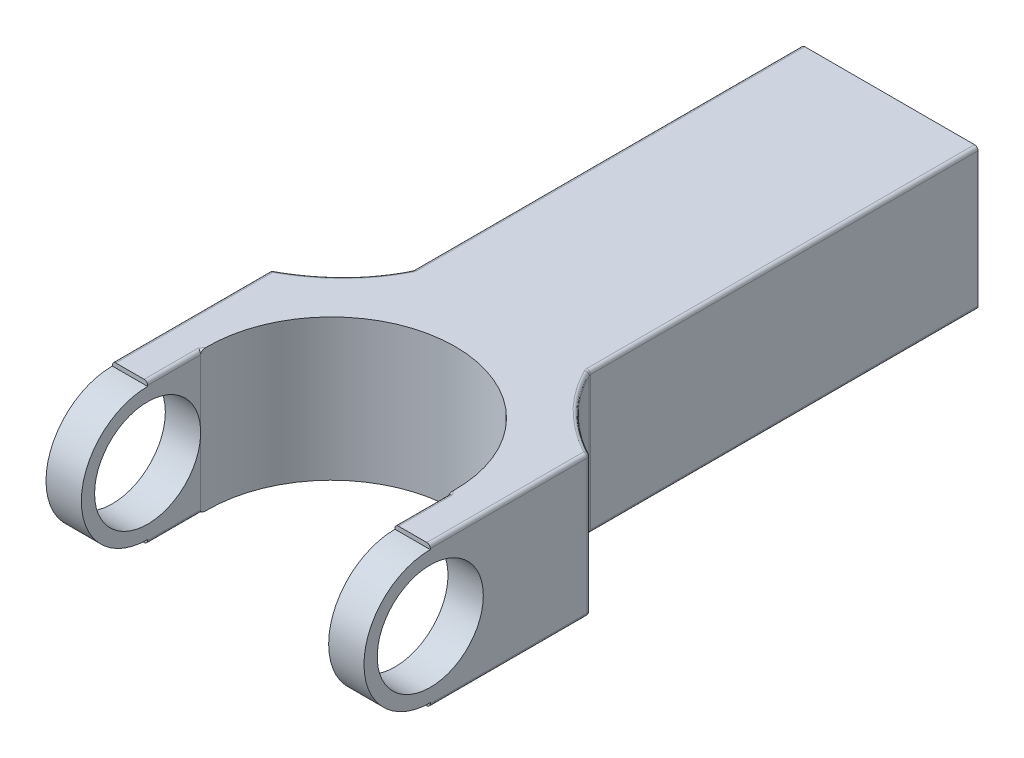
from build123d import *

# Parameters (mm, degrees)
BOSS_EXTRUDE4_DEPTH = 80
SKETCH7_R           = 30
CUT_EXTRUDE5_DEPTH  = 40
FILLET2_R           = 2
CUT_EXTRUDE6_DEPTH  = 305.00000000000017
CUT_EXTRUDE7_DEPTH  = 305.00000000000017
CUT_EXTRUDE8_DEPTH  = 305.00000000000017


with BuildPart() as part:
    # Sketch1 → Boss-Extrude4 (new body)
    with BuildSketch(Plane(origin=(0, 0, 0), x_dir=(1, 0, 0), z_dir=(0, 1, 0))):
        with BuildLine():
            Line((0, 199.83872485399064), (0, 59.951617456197184))
            add(Edge.make_bspline(
                [(69.94355369889674, 0), (40.61007984038975, 38.24826155662546), (4.77e-15, 59.951617456197184)],
                knots=[0, 0, 0, 0.9866116392258861, 0.9866116392258861, 0.9866116392258861], degree=2))
            Line((69.94355369889674, 0), (69.94355369889675, -69.94355369889672))
            Line((69.94355369889675, -69.94355369889672), (89.92742618429578, -69.94355369889672))
            Line((89.92742618429578, -69.94355369889674), (89.92742618429578, -59.951617456197184))
            Line((89.92742618429574, -59.95161745619719), (89.92742618429575, -29.95161745619719))
            Line((89.92742618429577, -29.951617456197184), (89.92742618429575, 0))
            Line((89.92742618429575, 0), (89.92742618429575, 0.04838254380280915))
            Line((89.92742618429575, 0.04838254380280915), (89.92742618429574, 59.951617456197184))
            add(Edge.make_bspline(
                [(89.92742618429574, 59.951617456197184), (62.391092666829216, 74.84042431676681), (49.95968121349766, 100.11035267924922)],
                knots=[0, 0, 0, 0.8990788323950668, 0.8990788323950668, 0.8990788323950668], degree=2))
            Line((49.95968121349766, 100.11035267924922), (49.95968121349765, 199.8387248539906))
            Line((49.95968121349765, 199.8387248539906), (49.95968121349765, 249.8387248539906))
            Line((49.95968121349765, 249.8387248539906), (49.95968121349765, 319.83872485399064))
            Line((49.95968121349765, 319.83872485399064), (0, 319.83872485399064))
            Line((0, 319.83872485399064), (0, 249.8387248539906))
            Line((0, 249.8387248539906), (0, 199.8387248539906))
        make_face()
    extrude(amount=BOSS_EXTRUDE4_DEPTH)

    # Sketch7 → Cut-Extrude5 (cut, symmetric)
    with BuildSketch(Plane(origin=(89.92742618429575, 0, -2.882e-14), x_dir=(-3.2e-16, 0, -1), z_dir=(1, 0, -3.2e-16))):
        with Locations((-29.94355369889675, 40)):
            Circle(SKETCH7_R)
    extrude(amount=CUT_EXTRUDE5_DEPTH, both=True, mode=Mode.SUBTRACT)

    # Mirror2: part across plane


with BuildPart() as part_1:
    add(part.part)
    add(part.part.mirror(Plane(origin=(0, 80, 0), x_dir=(0, 0, 1), z_dir=(1, 0, 0))))

    # Fillet2
    fillet2_edges = [part_1.edges().sort_by_distance(p)[0] for p in [
        (69.94355369889674, 80, 34.97177684944836),
        (49.95968121349766, 0, -209.97453876661993),
        (66.16732318286296, 0, -77.43570469224501),
        (89.92742618429577, 0, 4.995968121349762),
        (69.94355369889674, 0, 34.97177684944836),
        (37.79092834491907, 0, -34.11203514236202),
        (49.95968121349766, 40, -100.11035267924922),
        (89.92742618429574, 40, -59.951617456197184),
        (89.92742618429577, 80, 4.995968121349776),
        (66.16732318286296, 80, -77.43570469224501),
        (49.95968121349765, 80, -209.97453876661993),
        (-37.79092834491907, 0, -34.11203514236202),
        (-69.94355369889674, 80, 34.97177684944836),
        (-89.92742618429577, 0, 4.995968121349762),
        (-89.92742618429574, 40, -59.951617456197184),
        (-66.16732318286296, 80, -77.43570469224501),
        (-49.95968121349766, 40, -100.11035267924922),
        (-49.95968121349766, 0, -209.97453876661993),
        (-37.79092834491907, 80, -34.11203514236202),
        (-49.95968121349765, 80, -209.97453876661993),
        (-89.92742618429577, 80, 4.995968121349776),
        (-69.94355369889674, 0, 34.97177684944836),
        (-66.16732318286296, 0, -77.43570469224501),
        (37.79092834491907, 80, -34.11203514236202),
    ]]
    fillet(fillet2_edges, radius=FILLET2_R - 0.0001)  # a hair under: the kernel refuses the full size

    # Sketch8 → Cut-Extrude6 (cut, symmetric)
    with BuildSketch(Plane(origin=(89.92742618429575, 0, -2.882e-14), x_dir=(-3.2e-16, 0, -1), z_dir=(1, 0, -3.2e-16))):
        with BuildLine():
            Line((-109.94355369889676, -1.9859555230674064), (-29.943553698896746, -1.9859555230674064))
            Line((-29.943553698896746, -1.9859555230674064), (-29.943553698896746, 2.500000000000002))
            ThreePointArc((-29.943553698896746, 2.500000000000002), (-67.44355369889675, 40.00000000000001), (-29.943553698896746, 77.5))
            Line((-29.943553698896746, 77.5), (-29.943553698896746, 81.9859555230674))
            Line((-29.943553698896746, 81.9859555230674), (-109.94355369889676, 81.9859555230674))
            Line((-109.94355369889676, 81.9859555230674), (-109.94355369889676, -1.9859555230674064))
        make_face()
    extrude(amount=CUT_EXTRUDE6_DEPTH, both=True, mode=Mode.SUBTRACT)

    # Sketch9 → Cut-Extrude7 (cut, symmetric)
    with BuildSketch(Plane(origin=(0, 80, 0), x_dir=(1, 0, 0), z_dir=(0, 1, 0))):
        with BuildLine():
            Line((-69.94355369889674, 0), (69.94355369889674, 0))
            ThreePointArc((69.94355369889674, 0), (-1.127e-14, 65.73212894836354), (-69.94355369889674, 0))
        make_face()
    extrude(amount=CUT_EXTRUDE7_DEPTH, both=True, mode=Mode.SUBTRACT)

    # Sketch10 → Cut-Extrude8 (cut, symmetric)
    with BuildSketch(Plane(origin=(0, 80, 0), x_dir=(1, 0, 0), z_dir=(0, 1, 0))):
        with BuildLine():
            Line((-69.94355369889674, 0), (69.94355369889674, 0))
            ThreePointArc((69.94355369889674, 0), (-1.287e-14, 74.10211244610485), (-69.94355369889674, 0))
        make_face()
    extrude(amount=CUT_EXTRUDE8_DEPTH, both=True, mode=Mode.SUBTRACT)


solid = part_1.part
